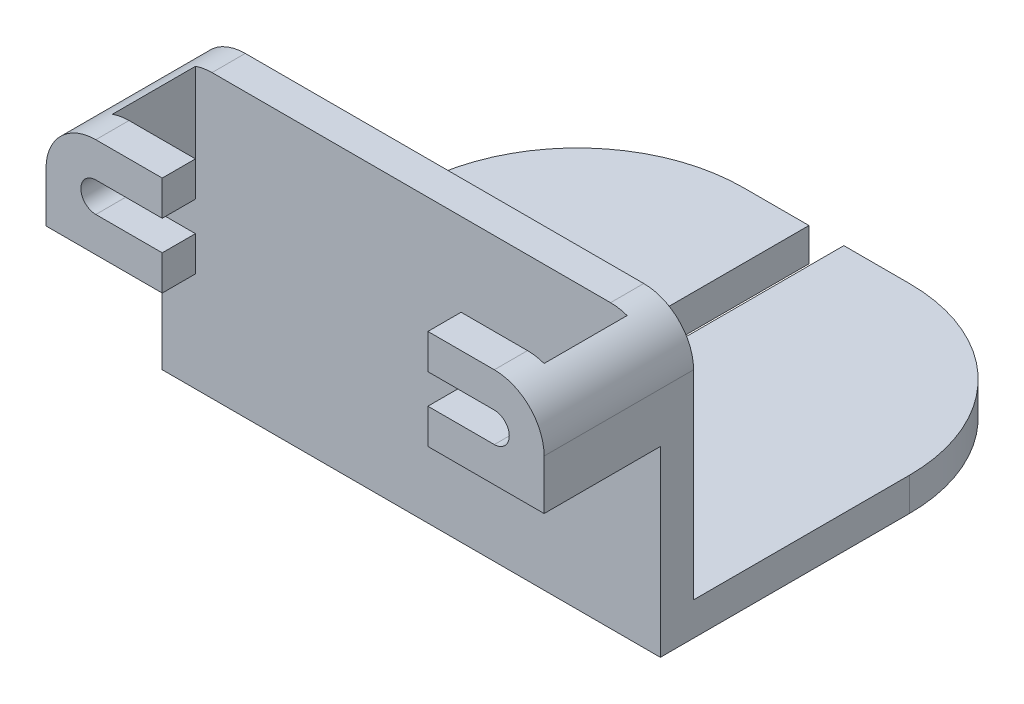
from build123d import *

# Parameters (mm, degrees)
EXTRUDE_1_DEPTH     = 30
EXTRUDE_2_DEPTH     = 6
CUT_EXTRUDE_1_DEPTH = 6
CUT_EXTRUDE_2_DEPTH = 6
FILLET_1_R          = 10
FILLET_2_R          = 3


with BuildPart() as part:
    # 草图1 → 凸台-拉伸1 (new body)
    with BuildSketch(Plane(origin=(0, 0, 0), x_dir=(0, 0, -1), z_dir=(1, 0, 0))):
        Polygon((0, 0), (25, 0), (25, 2), (2, 2), (2, 17), (0, 17), align=None)
    extrude(amount=EXTRUDE_1_DEPTH)

    # 草图3 → 凸台-拉伸2 (add)
    with BuildSketch(Plane(origin=(0, 17, 0), x_dir=(1, 0, 0), z_dir=(0, 1, 0))):
        Polygon((0, 0), (0, -7), (7, -7), (7, -5), (2, -5), (2, 0), align=None)
        Polygon((28, -5), (28, 0), (30, 0), (30, -7), (23, -7), (23, -5), align=None)
    extrude(amount=-EXTRUDE_2_DEPTH)

    # 草图4 → 切除-拉伸1 (cut)
    with BuildSketch(Plane.XY.offset(7)):
        with BuildLine():
            Line((22.34696537, 14.9), (27, 14.9))
            ThreePointArc((27, 14.9), (27.9, 14), (27, 13.1))
            Line((27, 13.1), (22.34696537, 13.1))
            ThreePointArc((22.34696537, 13.1), (21.44696537, 14), (22.34696537, 14.9))
        make_face()
        with BuildLine():
            Line((7.65303463, 14.9), (3, 14.9))
            ThreePointArc((3, 14.9), (2.1, 14), (3, 13.1))
            Line((3, 13.1), (7.65303463, 13.1))
            ThreePointArc((7.65303463, 13.1), (8.55303463, 14), (7.65303463, 14.9))
        make_face()
    extrude(amount=-CUT_EXTRUDE_1_DEPTH, mode=Mode.SUBTRACT)

    # 草图5 → 切除-拉伸2 (cut)
    with BuildSketch(Plane(origin=(0, 2, 0), x_dir=(1, 0, 0), z_dir=(0, 1, 0))):
        with BuildLine():
            Line((16.05, 25.529105391), (16.05, 11.529105391))
            ThreePointArc((16.05, 11.529105391), (15, 10.479105391), (13.95, 11.529105391))
            Line((13.95, 11.529105391), (13.95, 25.529105391))
            ThreePointArc((13.95, 25.529105391), (15, 26.579105391), (16.05, 25.529105391))
        make_face()
    extrude(amount=-CUT_EXTRUDE_2_DEPTH, mode=Mode.SUBTRACT)

    # 圆角1
    fillet_1_edges = [part.edges().sort_by_distance(p)[0] for p in [
        (30, 1, -25),
        (0, 1, -25),
    ]]
    fillet(fillet_1_edges, radius=FILLET_1_R)

    # 圆角2
    # the kernel refuses this fillet: 3 mm, written as the material it takes off along each edge
    with BuildSketch(Plane(origin=(30, 17, -9.5), x_dir=(0, -1, 0), z_dir=(0, 0, 1)), Plane(origin=(0, 17, 14.5), x_dir=(0, -1, 0), z_dir=(0, 0, -1))) as fillet_2_piece_1:
        with BuildLine():
            CenterArc((FILLET_2_R, -FILLET_2_R), FILLET_2_R, 90, 90)
            Line((0, -FILLET_2_R), (0, 0))
            Line((0, 0), (FILLET_2_R, 0))
        make_face()
    extrude(amount=24, mode=Mode.SUBTRACT)


solid = part.part
